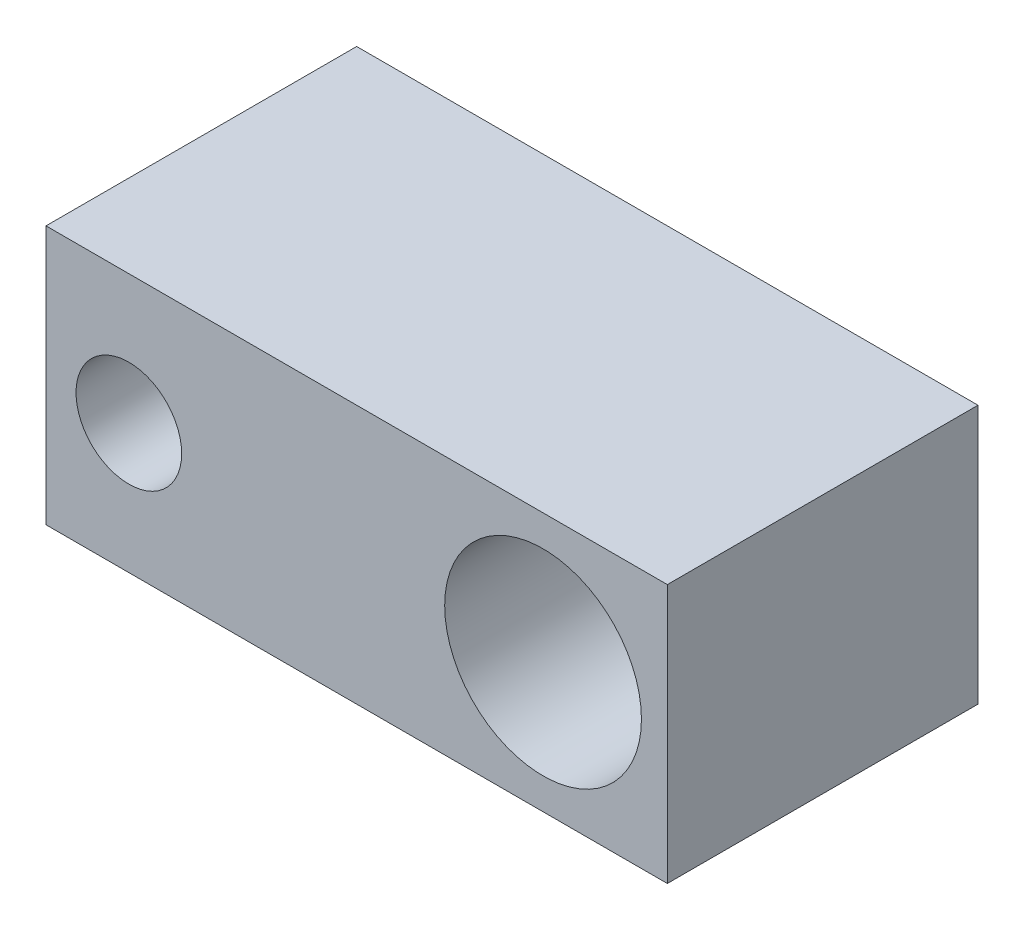
from build123d import *

# Parameters (mm, degrees)
SKETCH1_W           = 60
SKETCH1_H           = 25
SKETCH1_R           = 9.5
SKETCH1_R_2         = 5.1
BOSS_EXTRUDE1_DEPTH = 30


with BuildPart() as part:
    # Sketch1 → Boss-Extrude1 (new body)
    with BuildSketch(Plane.XY):
        Rectangle(SKETCH1_W, SKETCH1_H)
        with Locations((18, 0)):
            Circle(SKETCH1_R, mode=Mode.SUBTRACT)
        with Locations((-22, 0)):
            Circle(SKETCH1_R_2, mode=Mode.SUBTRACT)
    extrude(amount=BOSS_EXTRUDE1_DEPTH)


solid = part.part
